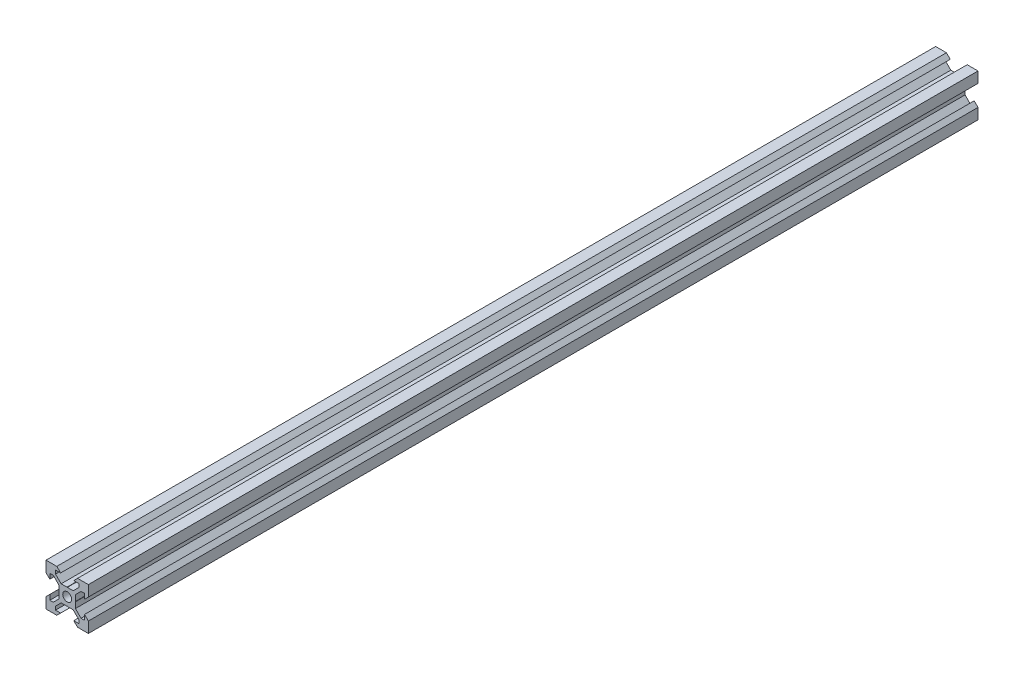
from build123d import *

# Parameters (mm, degrees)
SKETCH1_R           = 2.1
BOSS_EXTRUDE1_DEPTH = 420
CUT_EXTRUDE1_DEPTH  = 420


# Read off the part's stored shape, not the designer's step: Cut-Extrude1
with BuildPart() as part:
    # Sketch1 → Boss-Extrude1 (new body)
    with BuildSketch(Plane.XY):
        Polygon((-10, -4.9), (-10, -10), (-4.9, -10), (-3.1, -8.2), (-5.499339828, -8.2), (-5.499339828, -6.56), (-2.84, -3.900660172), (2.84, -3.900660172), (5.499339828, -6.56), (5.499339828, -8.2), (3.1, -8.2), (4.9, -10), (10, -10), (10, -4.9), (8.2, -3.1), (8.2, -5.499339828), (6.56, -5.499339828), (3.900660172, -2.84), (3.900660172, 2.84), (6.56, 5.499339828), (8.2, 5.499339828), (8.2, 3.1), (10, 4.9), (10, 10), (4.9, 10), (3.1, 8.2), (5.499339828, 8.2), (5.499339828, 6.56), (2.84, 3.900660172), (-2.84, 3.900660172), (-5.499339828, 6.56), (-5.499339828, 8.2), (-3.1, 8.2), (-4.9, 10), (-10, 10), (-10, 4.9), (-8.2, 3.1), (-8.2, 5.499339828), (-6.56, 5.499339828), (-3.900660172, 2.84), (-3.900660172, -2.84), (-6.56, -5.499339828), (-8.2, -5.499339828), (-8.2, -3.1), align=None)
        with Locations(Location((0, 0, 0), (0, 0, 270))):
            Circle(SKETCH1_R, mode=Mode.SUBTRACT)
    extrude(amount=BOSS_EXTRUDE1_DEPTH)

    # Cut-Extrude1 outline → Cut-Extrude1 (cut)
    with BuildSketch(Plane.XY):
        with BuildLine():
            ThreePointArc((3.900660172, 0.1), (3.800660172, 0), (3.900660172, -0.1))
            Line((3.900660172, -0.1), (3.900660172, 0.1))
        make_face()
        with BuildLine():
            ThreePointArc((0.1, -3.900660172), (0, -3.800660172), (-0.1, -3.900660172))
            Line((-0.1, -3.900660172), (0.1, -3.900660172))
        make_face()
        with BuildLine():
            ThreePointArc((-3.900660172, -0.1), (-3.800660172, 0), (-3.900660172, 0.1))
            Line((-3.900660172, 0.1), (-3.900660172, -0.1))
        make_face()
        with BuildLine():
            ThreePointArc((-0.1, 3.900660172), (0, 3.800660172), (0.1, 3.900660172))
            Line((0.1, 3.900660172), (-0.1, 3.900660172))
        make_face()
    extrude(amount=CUT_EXTRUDE1_DEPTH, mode=Mode.SUBTRACT)


solid = part.part
